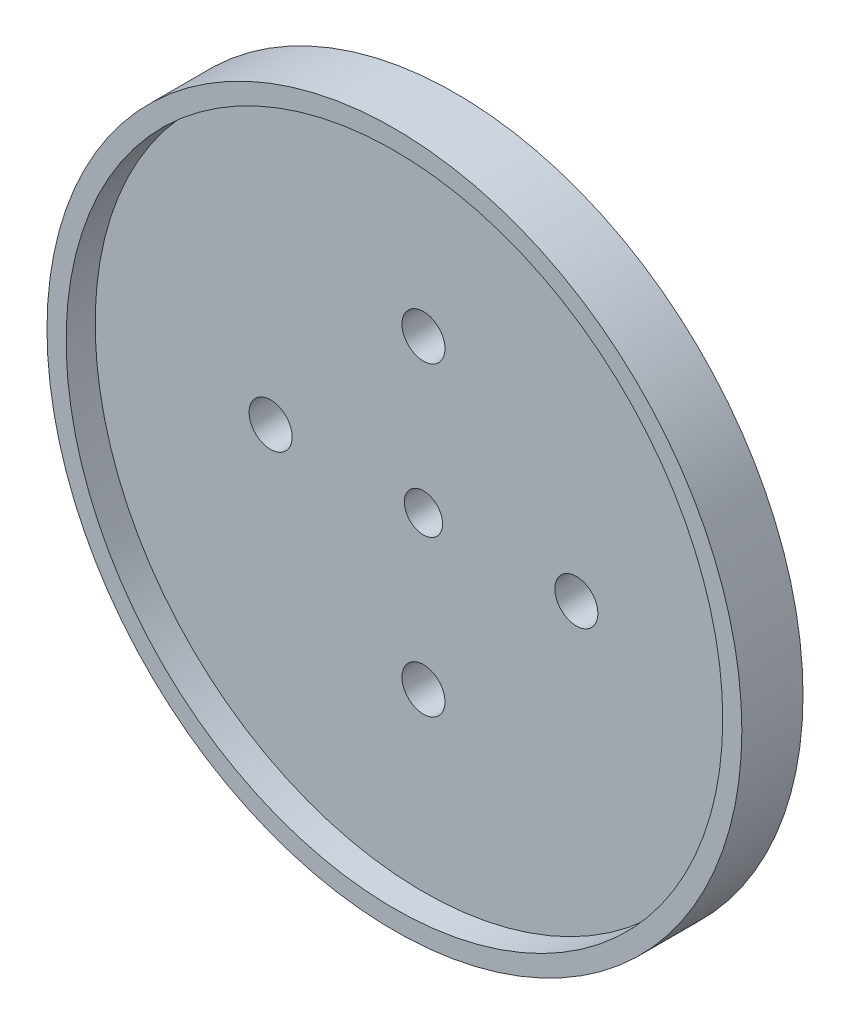
from build123d import *

# Parameters (mm, degrees)
SKETCH1_R                       = 57.7215
EXTRUDE1_DEPTH                  = 10.16
SKETCH2_R                       = 54.5465
EXTRUDE2_DEPTH                  = 4.826
F_1_4_0_25_DIAMETER_HOLE1_D     = 6.35
F_1_4_0_25_DIAMETER_HOLE1_DEPTH = 6.35
F_1_4_0_25_DIAMETER_HOLE1_TIP   = 1.907732465
F_1_4_CLEARANCE_HOLE1_D         = 7.14248
CIRPATTERN1_COUNT               = 4


with BuildPart() as part:
    # Sketch1 → Extrude1 (new body)
    with BuildSketch(Plane.XY):
        Circle(SKETCH1_R)
    extrude(amount=EXTRUDE1_DEPTH)

    # Sketch2 → Extrude2 (cut)
    with BuildSketch(Plane.XY.offset(10.16)):
        Circle(SKETCH2_R)
    extrude(amount=-EXTRUDE2_DEPTH, mode=Mode.SUBTRACT)

    # 1/4 (0.25) Diameter Hole1
    with Locations(Plane.XY.offset(5.334)):
        with Locations((0, 0)):
            Hole(F_1_4_0_25_DIAMETER_HOLE1_D / 2, depth=F_1_4_0_25_DIAMETER_HOLE1_DEPTH)
            with Locations((0, 0, -(F_1_4_0_25_DIAMETER_HOLE1_DEPTH + F_1_4_0_25_DIAMETER_HOLE1_TIP / 2))):  # 118° drill point
                Cone(0, F_1_4_0_25_DIAMETER_HOLE1_D / 2, F_1_4_0_25_DIAMETER_HOLE1_TIP, mode=Mode.SUBTRACT)

    # 1/4 Clearance Hole1 (through all)
    with Locations(Plane(origin=(25.4, 0, 5.334), x_dir=(1, 0, 0), z_dir=(0, 0, 1))):
        with Locations((0, 0)):
            f_1_4_clearance_hole1 = Hole(F_1_4_CLEARANCE_HOLE1_D / 2)

    # CirPattern1: 1/4 Clearance Hole1 ×4 about axis
    cirpattern1_axis = Axis((0, 0, 10.16), (0, 0, -1))
    for i in range(1, CIRPATTERN1_COUNT):
        add(f_1_4_clearance_hole1.rotate(cirpattern1_axis, i * 360 / CIRPATTERN1_COUNT), mode=Mode.SUBTRACT)


solid = part.part
